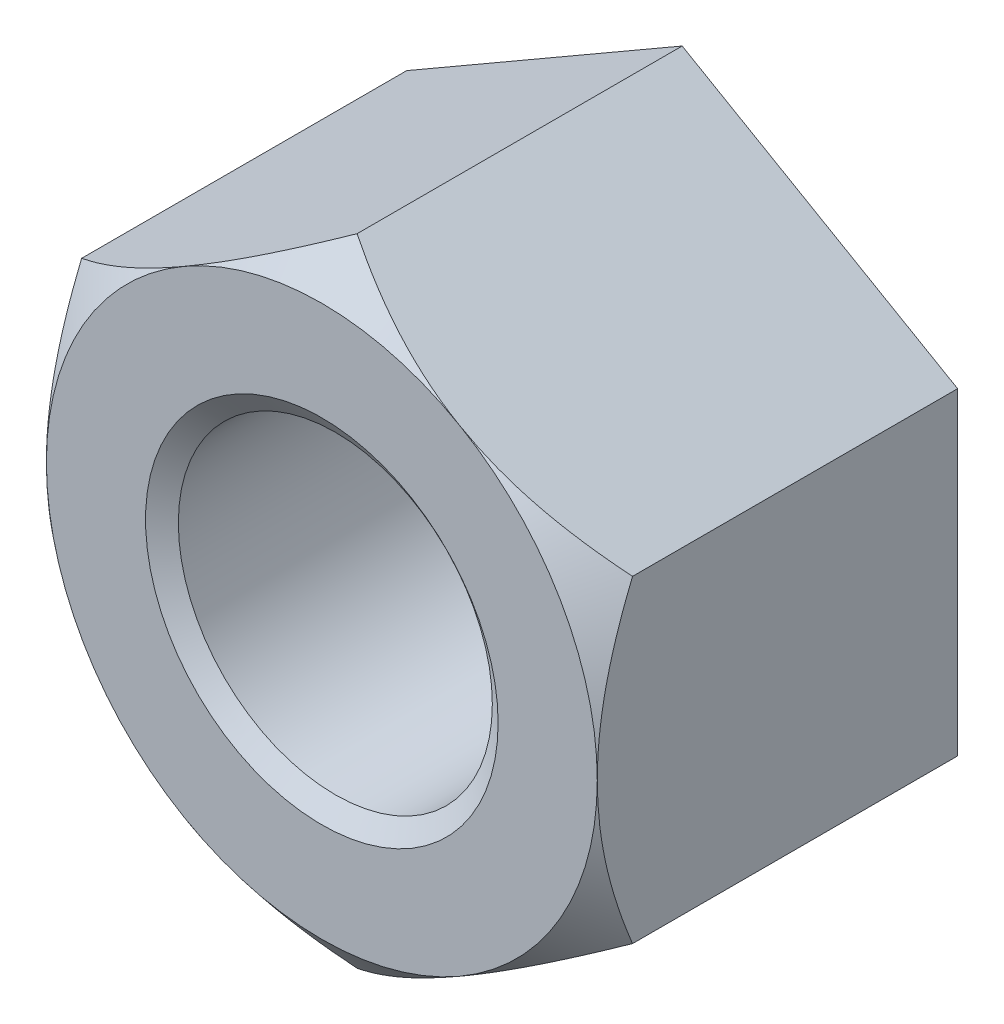
from build123d import *

# Parameters (mm, degrees)
THREADSCHEMATIC_START     = -51.9176
THREADSCHEMATIC_OUTLINE_R = 22.62124
THREADSCHEMATIC_DEPTH     = 51.9176


# Read off the part's stored shape, not the designer's step: ThreadSchematic
with BuildPart() as part:
    # ThreadSchematic outline → ThreadSchematic (new body)
    with BuildSketch(Plane.XY.offset(THREADSCHEMATIC_START)):
        Polygon((39.6875, 22.913588808), (0, 45.827177617), (-39.6875, 22.913588808), (-39.6875, -22.913588808), (0, -45.827177617), (39.6875, -22.913588808), align=None)
        Circle(THREADSCHEMATIC_OUTLINE_R, mode=Mode.SUBTRACT)
    extrude(amount=THREADSCHEMATIC_DEPTH)

    # Sketch2 → Single-Chamfer (revolve, cut)
    with BuildSketch(Plane(origin=(0, 0, 0), x_dir=(0, 0, -1), z_dir=(1, 0, 0))):
        Polygon((0, 39.6875), (-12.7, 39.6875), (-12.7, 58.527177617), (5.08, 58.527177617), (5.08, 45.827177617), align=None)
    revolve(axis=Axis((0, 0, 0), (0, 0, -1)), mode=Mode.SUBTRACT)

    # Sketch3 → EndChamfer (revolve, cut)
    with BuildSketch(Plane(origin=(0, 0, 0), x_dir=(0, 0, -1), z_dir=(1, 0, 0)), mode=Mode.PRIVATE) as endchamfer_sk:
        Polygon((51.8922, 25.4), (49.751920431, 22.343364), (51.943, 22.343364), (51.943, 25.4), align=None)
        Polygon((-0.0508, 25.4), (0, 25.4), (2.140279569, 22.343364), (-0.0508, 22.343364), align=None)
    revolve(endchamfer_sk.sketch.rotate(Axis((0, 0, -25.037505729), (0, 0, -1)), 90), axis=Axis((0, 0, -25.037505729), (0, 0, -1)), mode=Mode.SUBTRACT)


solid = part.part
